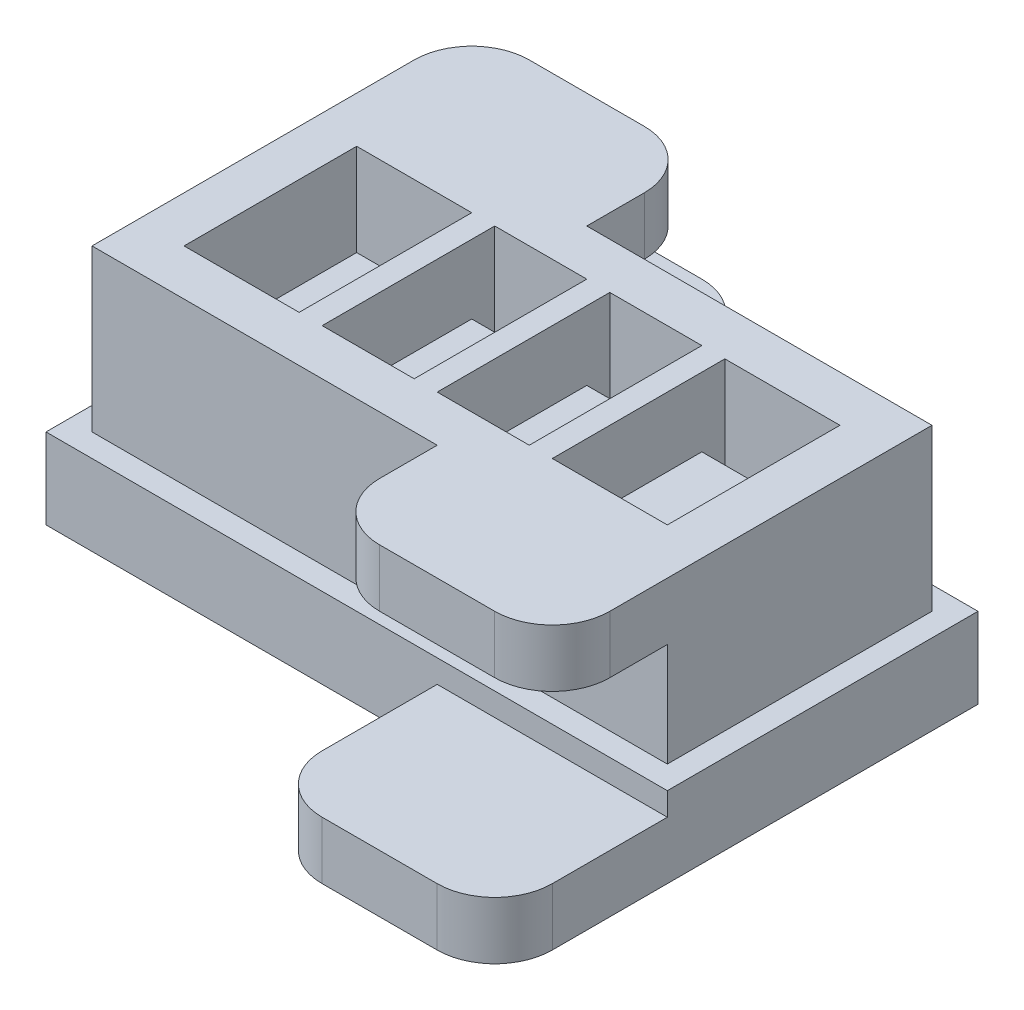
from build123d import *

# Parameters (mm, degrees)
SKETCH1_W                = 8
SKETCH1_H                = 15
BOSS_EXTRUDE1_DEPTH      = 15
SKETCH2_W                = 4
SKETCH2_H                = 7
CUT_EXTRUDE1_DEPTH       = 11
SKETCH3_W                = 15
SKETCH3_H                = 3
BOSS_EXTRUDE2_DEPTH      = 2
LPATTERN1_COUNT          = 4
LPATTERN1_PITCH          = 10
SKETCH4_W                = 15
SKETCH4_H                = 12
BOSS_EXTRUDE3_DEPTH      = 2
SKETCH5_W                = 15
SKETCH5_H                = 15
BOSS_EXTRUDE4_DEPTH      = 2
SKETCH6_W                = 34
SKETCH6_H                = 2
CUT_EXTRUDE2_DEPTH       = 2
SKETCH7_W                = 36
SKETCH7_H                = 9
SKETCH7_W_2              = 34
SKETCH7_H_2              = 7
BOSS_EXTRUDE5_DEPTH      = 2
SKETCH8_W                = 4
SKETCH8_H                = 0.5
BOSS_EXTRUDE6_DEPTH      = 2
LPATTERN2_COUNT          = 3
LPATTERN2_PITCH          = 10
BOSS_EXTRUDE7_DEPTH      = 15
BOSS_EXTRUDE7_DEPTH_BACK = 6
SKETCH9_W                = 50
SKETCH9_H                = 23
SPLIT1_START             = -6
SPLIT1_OUTLINE_W         = 50
SPLIT1_OUTLINE_H         = 23
SPLIT1_DEPTH             = 6
SPLIT1_2_OUTLINE_W       = 4
SPLIT1_2_OUTLINE_H       = 7
SPLIT1_2_DEPTH           = 11
SPLIT1_3_OUTLINE_W       = 6
SPLIT1_3_OUTLINE_H       = 2
SPLIT1_3_DEPTH           = 2
SPLIT1_START_2           = -19
SPLIT1_4_DEPTH           = 23
SPLIT1_START_3           = -11
SPLIT1_5_DEPTH           = 7
SPLIT1_6_OUTLINE_W       = 36
SPLIT1_6_OUTLINE_H       = 2
SPLIT1_6_DEPTH           = 7
SPLIT1_START_4           = -3
SPLIT1_7_OUTLINE_W       = 36
SPLIT1_7_OUTLINE_H       = 2
SPLIT1_7_DEPTH           = 7
SPLIT1_START_5           = -8.5
SPLIT1_8_DEPTH           = 2
SPLIT1_START_6           = -9.5
SPLIT1_9_OUTLINE_W       = 4
SPLIT1_9_OUTLINE_H       = 2
SPLIT1_9_DEPTH           = 4
SPLIT1_10_OUTLINE_W      = 4
SPLIT1_10_OUTLINE_H      = 2
SPLIT1_10_DEPTH          = 1
SPLIT1_START_7           = -5
SPLIT1_11_OUTLINE_W      = 4
SPLIT1_11_OUTLINE_H      = 2
SPLIT1_11_DEPTH          = 1
SKETCH11_W               = 20
SKETCH11_H               = 5
BOSS_EXTRUDE8_DEPTH      = 10
SKETCH12_W               = 20
SKETCH12_H               = 5
BOSS_EXTRUDE9_DEPTH      = 10
FILLET1_R                = 5
SKETCH13_W               = 54
SKETCH13_H               = 27
SKETCH13_W_2             = 50
SKETCH13_H_2             = 23
BOSS_EXTRUDE11_DEPTH     = 7
SKETCH14_W               = 20
SKETCH14_H               = 5
BOSS_EXTRUDE12_DEPTH     = 15
SKETCH15_W               = 20
SKETCH15_H               = 5
BOSS_EXTRUDE13_DEPTH     = 15
FILLET2_R                = 5


# Read off the part's stored shape, not the designer's step: Split1
with BuildPart() as part:
    # Sketch1 → Boss-Extrude1 (new body)
    with BuildSketch(Plane(origin=(0, 0, 0), x_dir=(1, 0, 0), z_dir=(0, 1, 0))):
        with Locations((4, 7.5)):
            Rectangle(SKETCH1_W, SKETCH1_H)
    extrude(amount=BOSS_EXTRUDE1_DEPTH)

    # Sketch2 → Cut-Extrude1 (cut)
    with BuildSketch(Plane.XZ):
        with Locations((4, -7.5)):
            Rectangle(SKETCH2_W, SKETCH2_H)
    extrude(amount=-CUT_EXTRUDE1_DEPTH, mode=Mode.SUBTRACT)

    # Sketch3 → Boss-Extrude2 (add)
    with BuildSketch(Plane.ZY):
        with Locations((-7.5, 1.5)):
            Rectangle(SKETCH3_W, SKETCH3_H)
    extrude(amount=BOSS_EXTRUDE2_DEPTH)


with BuildPart() as lpattern1_1:
    # LPattern1: pattern copy
    add(part.part.moved(Location(Vector(-1, 0, 0) * (1 * LPATTERN1_PITCH))))


with BuildPart() as lpattern1_2:
    # LPattern1: pattern copy
    add(part.part.moved(Location(Vector(-1, 0, 0) * (2 * LPATTERN1_PITCH))))


with BuildPart() as lpattern1_3:
    # LPattern1: pattern copy
    add(part.part.moved(Location(Vector(-1, 0, 0) * (3 * LPATTERN1_PITCH))))


with BuildPart() as lpattern1_2_1:
    add(lpattern1_2.part)

    # Combine1: union LPattern1_1, part, LPattern1_3
    add(lpattern1_1.part)
    add(part.part)
    add(lpattern1_3.part)

    # Sketch4 → Boss-Extrude3 (add)
    with BuildSketch(Plane.ZY.offset(30)):
        with Locations((-7.5, 9)):
            Rectangle(SKETCH4_W, SKETCH4_H)
    extrude(amount=BOSS_EXTRUDE3_DEPTH)

    # Sketch5 → Boss-Extrude4 (add)
    with BuildSketch(Plane(origin=(8, 0, 0), x_dir=(0, 0, -1), z_dir=(1, 0, 0))):
        with Locations((7.5, 7.5)):
            Rectangle(SKETCH5_W, SKETCH5_H)
    extrude(amount=BOSS_EXTRUDE4_DEPTH)

    # Sketch6 → Cut-Extrude2 (cut)
    with BuildSketch(Plane(origin=(0, 0, 0), x_dir=(-1, 0, 0), z_dir=(0, -1, 0))):
        with Locations((11, 7.5)):
            Rectangle(SKETCH6_W, SKETCH6_H)
    extrude(amount=-CUT_EXTRUDE2_DEPTH, mode=Mode.SUBTRACT)

    # Sketch7 → Boss-Extrude5 (add)
    with BuildSketch(Plane.XZ):
        with Locations((-11, -7.5)):
            Rectangle(SKETCH7_W, SKETCH7_H)
        with Locations((-11, -7.5)):
            Rectangle(SKETCH7_W_2, SKETCH7_H_2, mode=Mode.SUBTRACT)
    extrude(amount=BOSS_EXTRUDE5_DEPTH)

    # Sketch8 → Boss-Extrude6 (add)
    with BuildSketch(Plane.XZ):
        with Locations((-21, -9.75)):
            Rectangle(SKETCH8_W, SKETCH8_H)
        with Locations((-21, -5.25)):
            Rectangle(SKETCH8_W, SKETCH8_H)
    boss_extrude6 = extrude(amount=BOSS_EXTRUDE6_DEPTH)

    # LPattern2: Boss-Extrude6 ×3
    with Locations(*[(i * LPATTERN2_PITCH, 0, 0) for i in range(1, LPATTERN2_COUNT)]):
        add(boss_extrude6)


with BuildPart() as body_2:
    # Sketch9 → Boss-Extrude7 (new, two sides: drawn at the far end of the back side and taken through both)
    with BuildSketch(Plane(origin=(0, 0, 0), x_dir=(1, 0, 0), z_dir=(0, 1, 0)).offset(-BOSS_EXTRUDE7_DEPTH_BACK)):
        with Locations((-11, 7.5)):
            Rectangle(SKETCH9_W, SKETCH9_H)
    extrude(amount=BOSS_EXTRUDE7_DEPTH + BOSS_EXTRUDE7_DEPTH_BACK)

    # Combine2: cut LPattern1_2
    add(lpattern1_2_1.part, mode=Mode.SUBTRACT)

    # Split1 outline → Split1 (cut)
    with BuildSketch(Plane(origin=(0, 0, 0), x_dir=(1, 0, 0), z_dir=(0, 1, 0)).offset(SPLIT1_START)):
        with Locations((-11, 7.5)):
            Rectangle(SPLIT1_OUTLINE_W, SPLIT1_OUTLINE_H)
    extrude(amount=SPLIT1_DEPTH, mode=Mode.SUBTRACT)

    # Split1 2 outline → Split1 2 (cut)
    with BuildSketch(Plane(origin=(0, 0, 0), x_dir=(1, 0, 0), z_dir=(0, 1, 0))):
        with Locations((-26, 7.5)):
            Rectangle(SPLIT1_2_OUTLINE_W, SPLIT1_2_OUTLINE_H)
        with Locations((-16, 7.5)):
            Rectangle(SPLIT1_2_OUTLINE_W, SPLIT1_2_OUTLINE_H)
        with Locations((-6, 7.5)):
            Rectangle(SPLIT1_2_OUTLINE_W, SPLIT1_2_OUTLINE_H)
        with Locations((4, 7.5)):
            Rectangle(SPLIT1_2_OUTLINE_W, SPLIT1_2_OUTLINE_H)
    extrude(amount=SPLIT1_2_DEPTH, mode=Mode.SUBTRACT)

    # Split1 3 outline → Split1 3 (cut)
    with BuildSketch(Plane(origin=(0, 0, 0), x_dir=(1, 0, 0), z_dir=(0, 1, 0))):
        with Locations((-21, 7.5)):
            Rectangle(SPLIT1_3_OUTLINE_W, SPLIT1_3_OUTLINE_H)
        with Locations((-11, 7.5)):
            Rectangle(SPLIT1_3_OUTLINE_W, SPLIT1_3_OUTLINE_H)
        with Locations((-1, 7.5)):
            Rectangle(SPLIT1_3_OUTLINE_W, SPLIT1_3_OUTLINE_H)
    extrude(amount=SPLIT1_3_DEPTH, mode=Mode.SUBTRACT)

    # Sketch11 → Boss-Extrude8 (add)
    with BuildSketch(Plane.XY.offset(4)):
        with Locations((4, 12.5)):
            Rectangle(SKETCH11_W, SKETCH11_H)
    extrude(amount=BOSS_EXTRUDE8_DEPTH)

    # Sketch12 → Boss-Extrude9 (add)
    with BuildSketch(Plane(origin=(0, 0, -19), x_dir=(-1, 0, 0), z_dir=(0, 0, -1))):
        with Locations((26, 12.5)):
            Rectangle(SKETCH12_W, SKETCH12_H)
    extrude(amount=BOSS_EXTRUDE9_DEPTH)

    # Fillet1
    fillet1_edges = [body_2.edges().sort_by_distance(p)[0] for p in [
        (-6, 12.5, 14),
        (14, 12.5, 14),
        (-36, 12.5, -29),
        (-16, 12.5, -29),
    ]]
    fillet(fillet1_edges, radius=FILLET1_R)


with BuildPart() as body_2_2:
    # Split1 4 outline → Split1 4 (new body)
    with BuildSketch(Plane.XY.offset(SPLIT1_START_2)):
        Polygon((7, -2), (-29, -2), (-29, 0), (-36, 0), (-36, -6), (14, -6), (14, 0), (7, 0), align=None)
    extrude(amount=SPLIT1_4_DEPTH)

    # Split1 5 outline → Split1 5 (add)
    with BuildSketch(Plane.XY.offset(SPLIT1_START_3)):
        Polygon((2, 11), (2, 0), (1, 0), (1, -2), (6, -2), (6, 11), align=None)
        Polygon((-4, 0), (-4, 11), (-8, 11), (-8, 0), (-9, 0), (-9, -2), (-3, -2), (-3, 0), align=None)
        Polygon((-14, 0), (-14, 11), (-18, 11), (-18, 0), (-19, 0), (-19, -2), (-13, -2), (-13, 0), align=None)
        Polygon((-28, -2), (-23, -2), (-23, 0), (-24, 0), (-24, 11), (-28, 11), align=None)
    extrude(amount=SPLIT1_5_DEPTH)

    # Split1 6 outline → Split1 6 (add)
    with BuildSketch(Plane.XY.offset(SPLIT1_START_2)):
        with Locations((-11, -1)):
            Rectangle(SPLIT1_6_OUTLINE_W, SPLIT1_6_OUTLINE_H)
    extrude(amount=SPLIT1_6_DEPTH)

    # Split1 7 outline → Split1 7 (add)
    with BuildSketch(Plane.XY.offset(SPLIT1_START_4)):
        with Locations((-11, -1)):
            Rectangle(SPLIT1_7_OUTLINE_W, SPLIT1_7_OUTLINE_H)
    extrude(amount=SPLIT1_7_DEPTH)

    # Split1 8 outline → Split1 8 (add)
    with BuildSketch(Plane.XY.offset(SPLIT1_START_5)):
        Polygon((2, 0), (2, 2), (-4, 2), (-4, 0), (-3, 0), (-3, -2), (1, -2), (1, 0), align=None)
        Polygon((-9, 0), (-8, 0), (-8, 2), (-14, 2), (-14, 0), (-13, 0), (-13, -2), (-9, -2), align=None)
        Polygon((-23, -2), (-19, -2), (-19, 0), (-18, 0), (-18, 2), (-24, 2), (-24, 0), (-23, 0), align=None)
    extrude(amount=SPLIT1_8_DEPTH)

    # Split1 9 outline → Split1 9 (add)
    with BuildSketch(Plane.XY.offset(SPLIT1_START_6)):
        with Locations((-1, -1)):
            Rectangle(SPLIT1_9_OUTLINE_W, SPLIT1_9_OUTLINE_H)
        with Locations((-11, -1)):
            Rectangle(SPLIT1_9_OUTLINE_W, SPLIT1_9_OUTLINE_H)
        with Locations((-21, -1)):
            Rectangle(SPLIT1_9_OUTLINE_W, SPLIT1_9_OUTLINE_H)
    extrude(amount=SPLIT1_9_DEPTH)

    # Split1 10 outline → Split1 10 (add)
    with BuildSketch(Plane.XY.offset(SPLIT1_START_3)):
        with Locations((-1, -1)):
            Rectangle(SPLIT1_10_OUTLINE_W, SPLIT1_10_OUTLINE_H)
        with Locations((-11, -1)):
            Rectangle(SPLIT1_10_OUTLINE_W, SPLIT1_10_OUTLINE_H)
        with Locations((-21, -1)):
            Rectangle(SPLIT1_10_OUTLINE_W, SPLIT1_10_OUTLINE_H)
    extrude(amount=SPLIT1_10_DEPTH)

    # Split1 11 outline → Split1 11 (add)
    with BuildSketch(Plane.XY.offset(SPLIT1_START_7)):
        with Locations((-1, -1)):
            Rectangle(SPLIT1_11_OUTLINE_W, SPLIT1_11_OUTLINE_H)
        with Locations((-11, -1)):
            Rectangle(SPLIT1_11_OUTLINE_W, SPLIT1_11_OUTLINE_H)
        with Locations((-21, -1)):
            Rectangle(SPLIT1_11_OUTLINE_W, SPLIT1_11_OUTLINE_H)
    extrude(amount=SPLIT1_11_DEPTH)

    # Sketch13 → Boss-Extrude11 (add)
    with BuildSketch(Plane.XZ.offset(6)):
        with Locations((-11, -7.5)):
            Rectangle(SKETCH13_W, SKETCH13_H)
        with Locations((-11, -7.5)):
            Rectangle(SKETCH13_W_2, SKETCH13_H_2, mode=Mode.SUBTRACT)
    extrude(amount=-BOSS_EXTRUDE11_DEPTH)

    # Sketch14 → Boss-Extrude12 (add)
    with BuildSketch(Plane.XY.offset(6)):
        with Locations((6, -3.5)):
            Rectangle(SKETCH14_W, SKETCH14_H)
    extrude(amount=BOSS_EXTRUDE12_DEPTH)

    # Sketch15 → Boss-Extrude13 (add)
    with BuildSketch(Plane(origin=(0, 0, -21), x_dir=(-1, 0, 0), z_dir=(0, 0, -1))):
        with Locations((28, -3.5)):
            Rectangle(SKETCH15_W, SKETCH15_H)
    extrude(amount=BOSS_EXTRUDE13_DEPTH)

    # Fillet2
    fillet2_edges = [body_2_2.edges().sort_by_distance(p)[0] for p in [
        (16, -3.5, 21),
        (-4, -3.5, 21),
        (-38, -3.5, -36),
        (-18, -3.5, -36),
    ]]
    fillet(fillet2_edges, radius=FILLET2_R)


solid = Compound([body_2.part, body_2_2.part])
